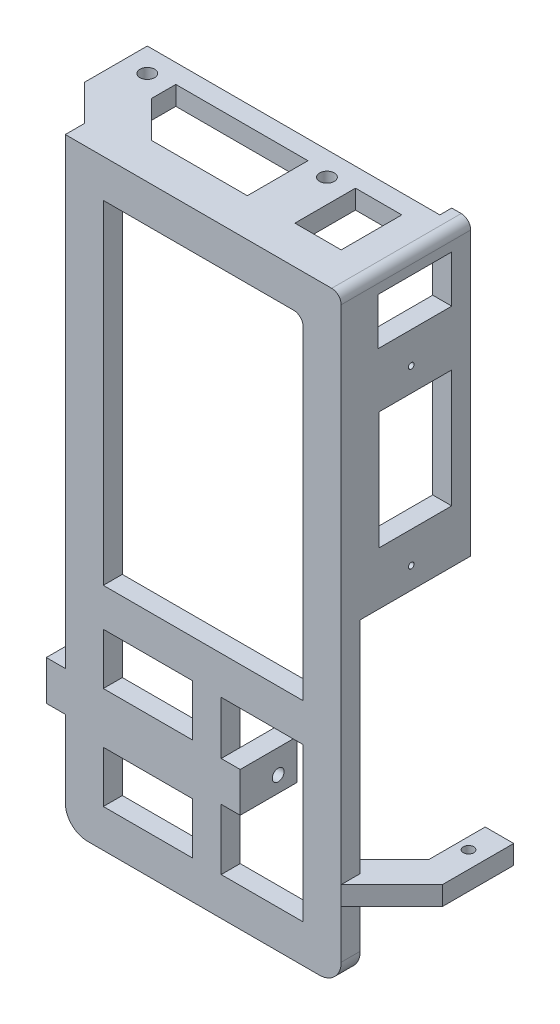
from build123d import *

# Parameters (mm, degrees)
SKETCH_4_W          = 23.255
SKETCH_4_H          = 57.4134
SKETCH_4_R          = 0.6
EXTRUDE_5_DEPTH     = 4
SKETCH_5_W          = 65.55
SKETCH_5_H          = 20.755
SKETCH_5_R          = 1.55
EXTRUDE_6_DEPTH     = 4
SKETCH_7_W          = 65.55
SKETCH_7_H          = 126.45
EXTRUDE_8_DEPTH     = 4
SKETCH_11_W         = 17.25
SKETCH_11_H         = 32.3
SKETCH_11_W_2       = 18.8
SKETCH_11_H_2       = 10.8
CUT_EXTRUDE_3_DEPTH = 125.085535116
EXTRUDE_9_DEPTH     = 4
CUT_EXTRUDE_4_DEPTH = 10
SKETCH_14_W         = 9.75
SKETCH_14_H         = 12.755
CUT_EXTRUDE_5_DEPTH = 10
SKETCH_16_W         = 15.255
SKETCH_16_H         = 24.775
SKETCH_16_W_2       = 15.505
SKETCH_16_H_2       = 9.88
CUT_EXTRUDE_6_DEPTH = 133.101854737
SKETCH_17_R         = 0.875
EXTRUDE_10_DEPTH    = 1
FILLET_1_R          = 0.5
EXTRUDE_2_DEPTH     = 4
CUT_EXTRUDE_7_REACH = 127.473
SKETCH_19_R         = 1.1
SKETCH_21_W         = 4
SKETCH_21_H         = 2.5
EXTRUDE_11_DEPTH    = 4
FILLET_2_R          = 2
FILLET_3_R          = 4.65


with BuildPart() as part:
    # 草图4 → 凸台-拉伸5 (new body)
    with BuildSketch(Plane(origin=(37.65, 0, 0), x_dir=(0, 0, -1), z_dir=(1, 0, 0))):
        with Locations((11.6275, 81.8433)):
            Rectangle(SKETCH_4_W, SKETCH_4_H)
        with Locations(Location((10.735, 94.05, 0), (0, 0, 90))):
            Circle(SKETCH_4_R, mode=Mode.SUBTRACT)
        with Locations(Location((10.735, 57.65, 0), (0, 0, 90))):
            Circle(SKETCH_4_R, mode=Mode.SUBTRACT)
    extrude(amount=EXTRUDE_5_DEPTH)

    # 草图5 → 凸台-拉伸6 (add)
    with BuildSketch(Plane(origin=(0, 110.55, 0), x_dir=(1, 0, 0), z_dir=(0, 1, 0))):
        with Locations((8.875, 10.3775)):
            Rectangle(SKETCH_5_W, SKETCH_5_H)
        with Locations(Location((-18.9, 15.755, 0), (0, 0, 180))):
            Circle(SKETCH_5_R, mode=Mode.SUBTRACT)
        with Locations(Location((18.9, 15.755, 0), (0, 0, 180))):
            Circle(SKETCH_5_R, mode=Mode.SUBTRACT)
    extrude(amount=EXTRUDE_6_DEPTH)

    # 草图7 → 凸台-拉伸8 (add)
    with BuildSketch(Plane.XY):
        with Locations((8.875, 51.325)):
            Rectangle(SKETCH_7_W, SKETCH_7_H)
    extrude(amount=EXTRUDE_8_DEPTH)

    # 草图11 → 切除-拉伸3 (cut, through all)
    with BuildSketch(Plane(origin=(0, 0, 0), x_dir=(-1, 0, 0), z_dir=(0, 0, -1))):
        with Locations((-25.025, 12.25)):
            Rectangle(SKETCH_11_W, SKETCH_11_H)
        Polygon((-33.65, 106.55), (-33.65, 36.4), (-16.4, 36.4), (8.4, 36.4), (8.4, 106.55), align=None)
        with Locations((-1, 1.5)):
            Rectangle(SKETCH_11_W_2, SKETCH_11_H_2)
        with Locations((-1, 23)):
            Rectangle(SKETCH_11_W_2, SKETCH_11_H_2)
        with BuildLine():
            ThreePointArc((16.4, -7.25), (15.038046533, -10.538046533), (11.75, -11.9))
            Line((11.75, -11.9), (23.9, -11.9))
            Line((23.9, -11.9), (23.9, 106.55))
            Line((23.9, 106.55), (16.4, 106.55))
            Line((16.4, 106.55), (16.4, -7.25))
        make_face()
    extrude(amount=-CUT_EXTRUDE_3_DEPTH, mode=Mode.SUBTRACT)

    # 草图12 → 凸台-拉伸9 (add)
    with BuildSketch(Plane(origin=(0, 2.890336251, 0), x_dir=(1, 0, 0), z_dir=(0, 1, 0))):
        with BuildLine():
            Line((46.295757056, 9.855), (50.995757056, 9.855))
            Line((50.995757056, 9.855), (50.995757056, 15.105))
            Line((50.995757056, 15.105), (49.455691264, 15.105))
            ThreePointArc((49.455691264, 15.105), (47.695757056, 15.755), (49.455691264, 16.405))
            Line((49.455691264, 16.405), (50.995757056, 16.405))
            Line((50.995757056, 16.405), (50.995757056, 21.655))
            Line((50.995757056, 21.655), (46.295757056, 21.655))
            Line((46.295757056, 21.655), (46.295757056, 9.855))
        make_face()
        Polygon((52.295757056, 6.645757056), (52.295757056, 9.855), (50.995757056, 9.855), (46.295757056, 9.855), (36.440757056, 0), (41.65, -4), align=None)
        with BuildLine():
            Line((52.295757056, 9.855), (52.295757056, 21.655))
            Line((52.295757056, 21.655), (50.995757056, 21.655))
            Line((50.995757056, 21.655), (50.995757056, 16.405))
            Line((50.995757056, 16.405), (49.455691264, 16.405))
            ThreePointArc((49.455691264, 16.405), (47.695757056, 15.755), (49.455691264, 15.105))
            Line((49.455691264, 15.105), (50.995757056, 15.105))
            Line((50.995757056, 15.105), (50.995757056, 9.855))
            Line((50.995757056, 9.855), (52.295757056, 9.855))
        make_face()
    extrude(amount=EXTRUDE_9_DEPTH)

    # 草图13 → 切除-拉伸4 (cut, symmetric)
    with BuildSketch(Plane.XZ.offset(-110.55)):
        Polygon((-23.9, -7.5), (-16.4, 0), (-16.4, 4), (-23.9, 4), align=None)
    extrude(amount=CUT_EXTRUDE_4_DEPTH, both=True, mode=Mode.SUBTRACT)

    # 草图14 → 切除-拉伸5 (cut)
    with BuildSketch(Plane.XZ.offset(-110.55)):
        with Locations((28.775, -10.3775)):
            Rectangle(SKETCH_14_W, SKETCH_14_H)
        Polygon((13.9, -16.755), (-13.9, -16.755), (-13.9, -11.642135624), (-6.257864376, -4), (13.9, -4), align=None)
    extrude(amount=-CUT_EXTRUDE_5_DEPTH, mode=Mode.SUBTRACT)

    # 草图16 → 切除-拉伸6 (cut, through all)
    with BuildSketch(Plane.ZY.offset(-37.65)):
        with Locations((-11.6275, 76.6625)):
            Rectangle(SKETCH_16_W, SKETCH_16_H)
        with Locations((-11.5025, 105.61)):
            Rectangle(SKETCH_16_W_2, SKETCH_16_H_2)
    extrude(amount=-CUT_EXTRUDE_6_DEPTH, mode=Mode.SUBTRACT)

    # 草图17 → 凸台-拉伸10 (add)
    with BuildSketch(Plane.ZY.offset(-37.65)):
        with Locations(Location((-10.735, 62.275, 0), (0, 0, 90))):
            Circle(SKETCH_17_R)
        with BuildLine():
            Line((-11.635, 97.922403852), (-11.635, 99.417596148))
            ThreePointArc((-11.635, 99.417596148), (-10.735, 99.84), (-9.835, 99.417596148))
            Line((-9.835, 99.417596148), (-9.835, 97.922403852))
            ThreePointArc((-9.835, 97.922403852), (-10.735, 97.5), (-11.635, 97.922403852))
        make_face()
    extrude(amount=EXTRUDE_10_DEPTH)

    # 圆角1
    # the kernel refuses this fillet: 0.5 mm, written as the material it takes off along each edge
    with BuildSketch(Plane(origin=(36.65, 62.275, -10.735), x_dir=(0, 1, 0), z_dir=(0, 0, 1))) as fillet_1_piece_1:
        with BuildLine():
            CenterArc((0.875 - FILLET_1_R, -FILLET_1_R), FILLET_1_R, 0, 90)
            Line((0.875 - FILLET_1_R, 0), (0.875, 0))
            Line((0.875, 0), (0.875, -FILLET_1_R))
        make_face()
    revolve(axis=Axis((36.65, 62.275, -10.735), (-1, 0, 0)), mode=Mode.SUBTRACT)
    with BuildSketch(Plane(origin=(36.65, 96.672403852, -11.635), x_dir=(1, 0, 0), z_dir=(0, 1, 0)), Plane(origin=(36.65, 100.667596148, -9.835), x_dir=(1, 0, 0), z_dir=(0, -1, 0))) as fillet_1_piece_2:
        with BuildLine():
            CenterArc((FILLET_1_R, -FILLET_1_R), FILLET_1_R, 90, 90)
            Line((0, -FILLET_1_R), (0, 0))
            Line((0, 0), (FILLET_1_R, 0))
        make_face()
    extrude(amount=3.995192295, mode=Mode.SUBTRACT)
    with BuildSketch(Plane(origin=(36.65, 98.67, -10.735), x_dir=(0, 0.36697225923969184, 0.9302318855793519), z_dir=(0, 0.9302318855793519, -0.36697225923969184))) as fillet_1_piece_3:
        with BuildLine():
            CenterArc((1.17 - FILLET_1_R, FILLET_1_R), FILLET_1_R, 270, 90)
            Line((1.17 - FILLET_1_R, 0), (1.17, 0))
            Line((1.17, 0), (1.17, FILLET_1_R))
        make_face()
    revolve(axis=Axis((36.65, 98.67, -10.735), (1, 0, 0)), revolution_arc=223.058018827, mode=Mode.SUBTRACT)
    with BuildSketch(Plane(origin=(36.65, 98.67, -10.735), x_dir=(0, -0.36697225923969184, -0.9302318855793519), z_dir=(0, -0.9302318855793519, 0.36697225923969184))) as fillet_1_piece_4:
        with BuildLine():
            CenterArc((1.17 - FILLET_1_R, FILLET_1_R), FILLET_1_R, 270, 90)
            Line((1.17 - FILLET_1_R, 0), (1.17, 0))
            Line((1.17, 0), (1.17, FILLET_1_R))
        make_face()
    revolve(axis=Axis((36.65, 98.67, -10.735), (1, 0, 0)), revolution_arc=223.058018827, mode=Mode.SUBTRACT)

    # 草图2 → 凸台-拉伸2 (add)
    with BuildSketch(Plane.ZY.offset(16.4)):
        Polygon((-8, 12.25), (-8, 8.9), (4, 8.9), (4, 17.25), (-8, 17.25), align=None)
        with BuildLine():
            ThreePointArc((-2.75, 12.25), (-4, 11), (-5.25, 12.25))
            ThreePointArc((-5.25, 12.25), (-4, 13.5), (-2.75, 12.25))
        make_face(mode=Mode.SUBTRACT)
    extrude_2 = extrude(amount=EXTRUDE_2_DEPTH)

    # 镜向10: 凸台-拉伸2 across plane
    add(extrude_2.mirror(Plane(origin=(0, 0, 0), x_dir=(0, 0, 1), z_dir=(1, 0, 0))))

    # 草图19 → 切除-拉伸7 (cut, up to next)
    with BuildSketch(Plane.XZ.offset(-2.890336251), mode=Mode.PRIVATE) as cut_extrude_7_sk1:
        with Locations((48.695757056, -15.755)):
            Circle(SKETCH_19_R)
    cut_extrude_7_tool1 = extrude(cut_extrude_7_sk1.sketch, amount=-CUT_EXTRUDE_7_REACH, mode=Mode.PRIVATE) & part.part
    add(cut_extrude_7_tool1.solids().sort_by_distance((48.695757, 2.890336, -15.755))[0], mode=Mode.SUBTRACT)

    # 草图21 → 凸台-拉伸11 (add)
    with BuildSketch(Plane(origin=(0, 110.55, 0), x_dir=(1, 0, 0), z_dir=(0, 1, 0))):
        with Locations((39.65, 22.005)):
            Rectangle(SKETCH_21_W, SKETCH_21_H)
    extrude(amount=EXTRUDE_11_DEPTH)

    # 圆角2
    fillet_2_edges = [part.edges().sort_by_distance(p)[0] for p in [
        (33.65, 106.55, 2),
        (37.65, 110.55, -1.875),
        (37.65, 110.55, -20.005),
        (41.65, 114.55, -9.6275),
    ]]
    fillet(fillet_2_edges, radius=FILLET_2_R)

    # 圆角3
    fillet_3_edges = [part.edges().sort_by_distance(p)[0] for p in [
        (41.65, -11.9, 2),
    ]]
    fillet(fillet_3_edges, radius=FILLET_3_R)


solid = part.part
